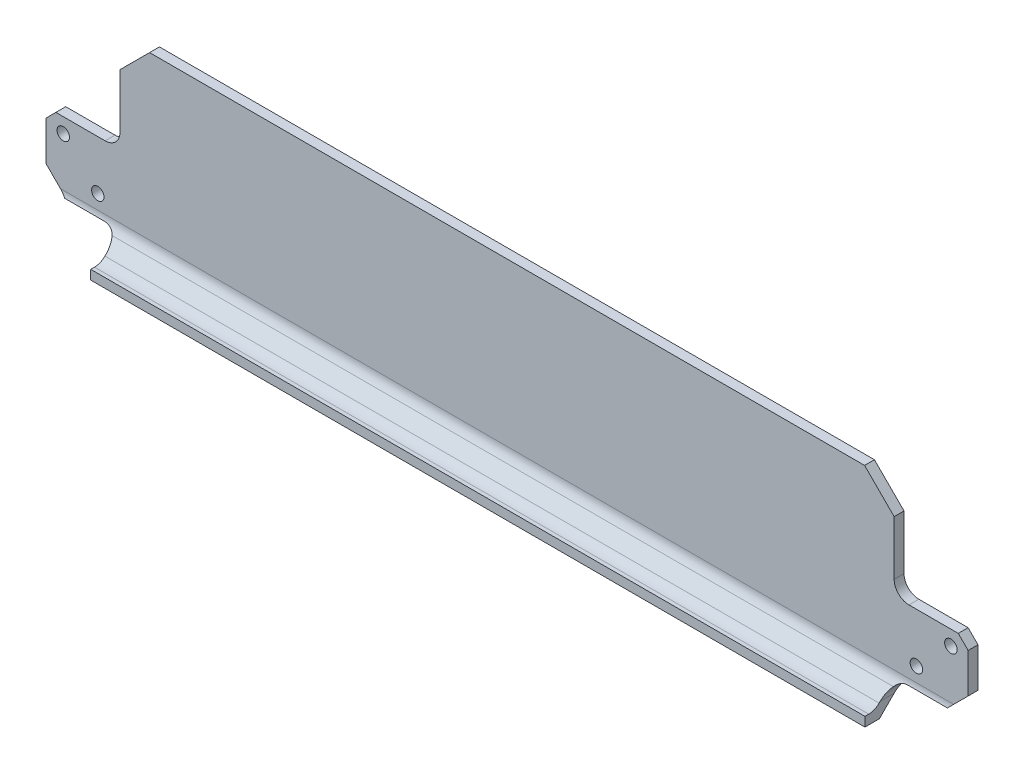
from build123d import *

# Parameters (mm, degrees)
BOSS_EXTRUDE1_DEPTH  = 99.695
SKETCH3_W            = 19.05
SKETCH3_H            = 17.78
SKETCH3_R            = 1.6002
MOUNTING_PLATE_DEPTH = 2.54
CHAMFER1_SIZE        = 5.08
CHAMFER2_SIZE        = 2.54
CHAMFER3_SIZE        = 7.62
FILLET1_R            = 3.81


with BuildPart() as part:
    # Sketch2 → Boss-Extrude1 (new, symmetric)
    with BuildSketch(Plane(origin=(0, 0, 0), x_dir=(0, 0, -1), z_dir=(1, 0, 0))):
        Polygon((-10.069102448, 0), (-6.35, 0), (0, 6.35), (0, 50.8), (-2.54, 50.8), (-2.54, 7.402102448), (-7.529102448, 2.413), (-10.069102448, 2.413), align=None)
    extrude(amount=BOSS_EXTRUDE1_DEPTH, both=True)

    # Sketch3 → Mounting-Plate (add)
    with BuildSketch(Plane.XY):
        with Locations((-109.22, 16.51)):
            Rectangle(SKETCH3_W, SKETCH3_H)
        with Locations(Location((-114.3, 21.59, 0), (0, 0, 90))):
            Circle(SKETCH3_R, mode=Mode.SUBTRACT)
        with Locations(Location((-105.41, 12.7, 0), (0, 0, 90))):
            Circle(SKETCH3_R, mode=Mode.SUBTRACT)
    mounting_plate = extrude(amount=MOUNTING_PLATE_DEPTH)

    # Mirror1: Mounting-Plate across plane
    add(mounting_plate.mirror(Plane(origin=(0, 0, 0), x_dir=(0, 0, 1), z_dir=(1, 0, 0))))

    # Chamfer1
    chamfer1_edges = [part.edges().sort_by_distance(p)[0] for p in [
        (-118.745, 7.62, 1.27),
        (118.745, 7.62, 1.27),
    ]]
    chamfer(chamfer1_edges, length=CHAMFER1_SIZE)

    # Chamfer2
    chamfer2_edges = [part.edges().sort_by_distance(p)[0] for p in [
        (-118.745, 25.4, 1.27),
        (118.745, 25.4, 1.27),
    ]]
    chamfer(chamfer2_edges, length=CHAMFER2_SIZE)

    # Chamfer3
    chamfer3_edges = [part.edges().sort_by_distance(p)[0] for p in [
        (99.695, 50.8, 1.27),
        (-99.695, 50.8, 1.27),
    ]]
    chamfer(chamfer3_edges, length=CHAMFER3_SIZE)

    # Fillet1
    fillet1_edges = [part.edges().sort_by_distance(p)[0] for p in [
        (0, 7.402102448, 2.54),
    ]]
    fillet(fillet1_edges, radius=FILLET1_R)
    fillet1_2_edges = [part.edges().sort_by_distance(p)[0] for p in [
        (-99.695, 25.4, 1.27),
    ]]
    fillet(fillet1_2_edges, radius=FILLET1_R)
    fillet1_3_edges = [part.edges().sort_by_distance(p)[0] for p in [
        (99.695, 25.4, 1.27),
    ]]
    fillet(fillet1_3_edges, radius=FILLET1_R)
    fillet1_4_edges = [part.edges().sort_by_distance(p)[0] for p in [
        (-99.695, 7.62, 1.395547606),
    ]]
    fillet(fillet1_4_edges, radius=FILLET1_R)
    fillet1_5_edges = [part.edges().sort_by_distance(p)[0] for p in [
        (0, 2.413, 7.529102448),
    ]]
    fillet(fillet1_5_edges, radius=FILLET1_R)
    fillet1_6_edges = [part.edges().sort_by_distance(p)[0] for p in [
        (99.695, 7.62, 1.395547606),
    ]]
    fillet(fillet1_6_edges, radius=FILLET1_R)


solid = part.part
